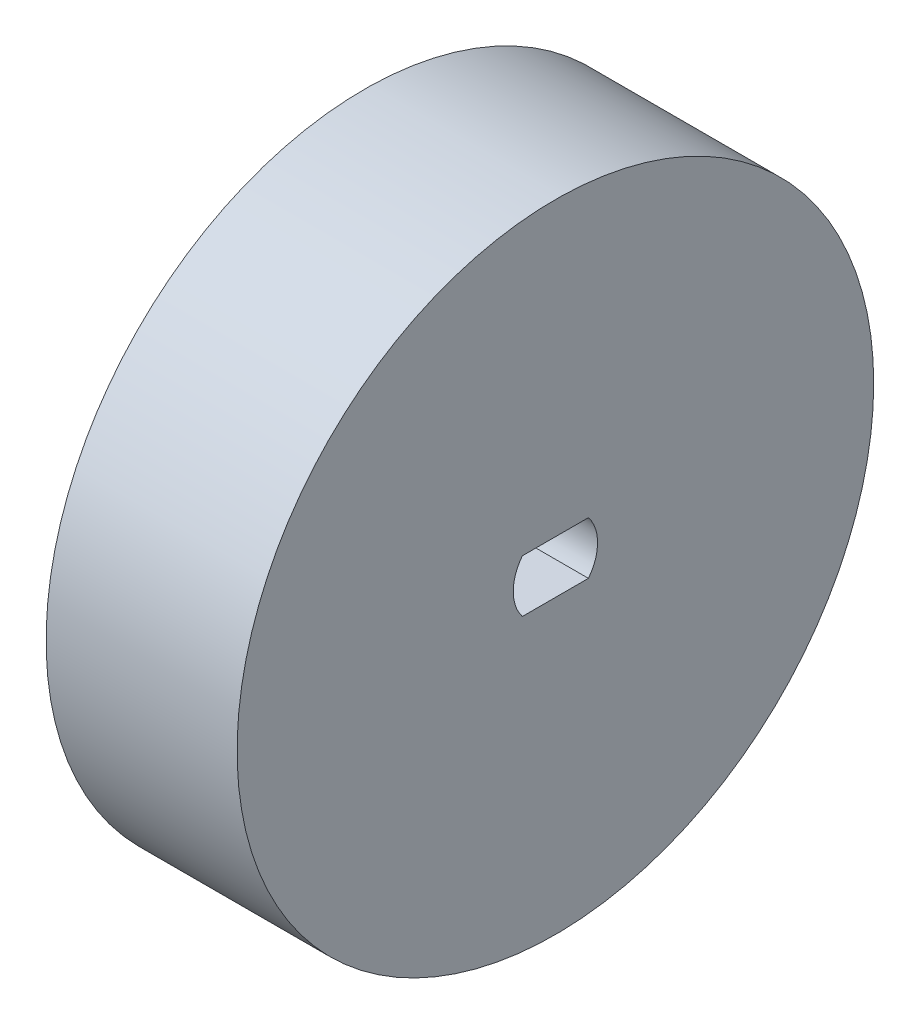
from build123d import *

# Parameters (mm, degrees)
SKETCH1_R           = 20
BOSS_EXTRUDE1_DEPTH = 12


with BuildPart() as part:
    # Sketch1 → Boss-Extrude1 (new body)
    with BuildSketch(Plane(origin=(0, 0, 0), x_dir=(0, 0, -1), z_dir=(1, 0, 0))):
        Circle(SKETCH1_R)
        with BuildLine():
            Line((-2.073644135, 1.65), (2.073644135, 1.65))
            ThreePointArc((2.073644135, 1.65), (2.65, 0), (2.073644135, -1.65))
            Line((2.073644135, -1.65), (-2.073644135, -1.65))
            ThreePointArc((-2.073644135, -1.65), (-2.65, 0), (-2.073644135, 1.65))
        make_face(mode=Mode.SUBTRACT)
    extrude(amount=-BOSS_EXTRUDE1_DEPTH)


solid = part.part
